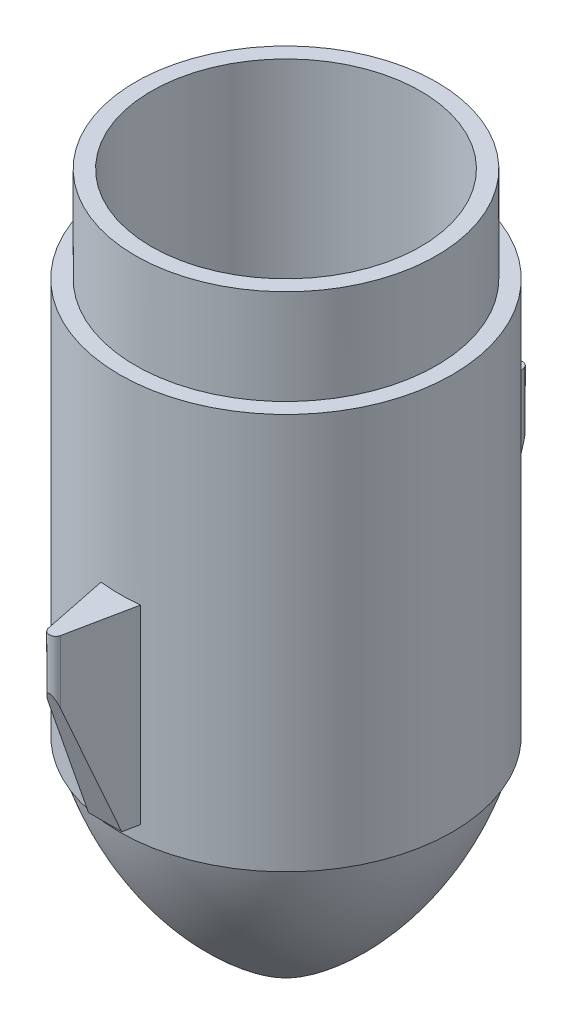
from build123d import *

# Parameters (mm, degrees)
SKETCH1_R           = 42.5
BOSS_EXTRUDE2_DEPTH = 150
SHELL1_T            = 5
SKETCH2_R           = 52.5
SKETCH2_R_2         = 47.5
BOSS_EXTRUDE3_DEPTH = 125
BOSS_EXTRUDE4_START = -60
BOSS_EXTRUDE4_DEPTH = 60
CUT_EXTRUDE1_DEPTH  = 7.5
CIRPATTERN1_COUNT   = 2
CIRPATTERN2_COUNT   = 2


with BuildPart() as part:
    # Sketch1 → Boss-Extrude2 (new body)
    with BuildSketch(Plane(origin=(0, 0, 0), x_dir=(1, 0, 0), z_dir=(0, 1, 0))):
        Circle(SKETCH1_R)
    extrude(amount=BOSS_EXTRUDE2_DEPTH)

    # Shell1
    shell1_openings = [part.faces().sort_by_distance(p)[0] for p in [
        (0, 150, 0),
    ]]
    offset(amount=SHELL1_T, openings=shell1_openings, kind=Kind.INTERSECTION)

    # Sketch2 → Boss-Extrude3 (add)
    with BuildSketch(Plane(origin=(0, -5, 0), x_dir=(-1, 0, 0), z_dir=(0, -1, 0))):
        Circle(SKETCH2_R)
        Circle(SKETCH2_R_2, mode=Mode.SUBTRACT)
    extrude(amount=-BOSS_EXTRUDE3_DEPTH)

    # Sketch3 → Revolve1 (revolve)
    with BuildSketch(Plane.XY):
        with BuildLine():
            Line((0, 0), (0, -70))
            ThreePointArc((0, -70), (-34.201936712, -40.963952534), (-52.5, 0))
            Line((-52.5, 0), (0, 0))
        make_face()
    revolve(axis=Axis((0, 0, 0), (0, -1, 0)))

    # Sketch4 → Boss-Extrude4 (add)
    with BuildSketch(Plane(origin=(0, 60, 0), x_dir=(1, 0, 0), z_dir=(0, 1, 0)).offset(BOSS_EXTRUDE4_START)):
        with BuildLine():
            Line((6.24539198, 52.127200951), (1.961572547, 73.12125305))
            ThreePointArc((1.961572547, 73.12125305), (0, 74.668746629), (-1.961572547, 73.12125305))
            Line((-1.961572547, 73.12125305), (-6.24539198, 52.127200951))
            ThreePointArc((-6.24539198, 52.127200951), (0, 52.5), (6.24539198, 52.127200951))
        make_face()
    boss_extrude4 = extrude(amount=BOSS_EXTRUDE4_DEPTH)

    # Sketch5 → Cut-Extrude1 (cut, symmetric)
    with BuildSketch(Plane(origin=(0, 0, 0), x_dir=(0, 0, -1), z_dir=(1, 0, 0))):
        Polygon((74.668746629, 43.94069989), (56.024180022, -2.622256865), (78.796904208, -2.622256865), (78.796904208, 43.94069989), align=None)
    cut_extrude1 = extrude(amount=CUT_EXTRUDE1_DEPTH, both=True, mode=Mode.SUBTRACT)

    # CirPattern1: Boss-Extrude4 ×2 about axis
    cirpattern1_axis = Axis((0, 120, 0), (0, -1, 0))
    for i in range(1, CIRPATTERN1_COUNT):
        add(boss_extrude4.rotate(cirpattern1_axis, i * 360 / CIRPATTERN1_COUNT))

    # CirPattern2: Cut-Extrude1 ×2 about axis
    cirpattern2_axis = Axis((0, 120, 0), (0, -1, 0))
    for i in range(1, CIRPATTERN2_COUNT):
        add(cut_extrude1.rotate(cirpattern2_axis, i * 360 / CIRPATTERN2_COUNT), mode=Mode.SUBTRACT)


solid = part.part
